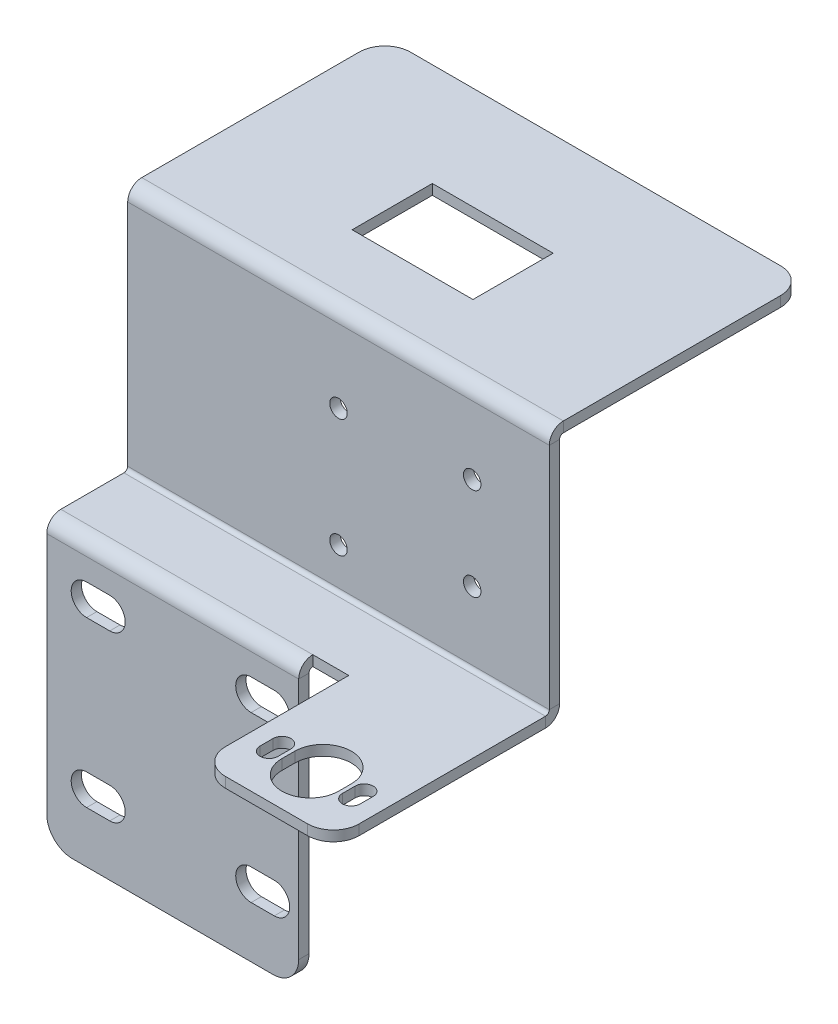
from build123d import *

# Parameters (mm, degrees)
SKETCH1_W                    = 82
SKETCH1_H                    = 50
SKETCH1_W_2                  = 23.5
SKETCH1_H_2                  = 15.6
BASE_FLANGE1_DEPTH           = 2
EDGE_FLANGE1_STRIP_W         = 9.4732
EDGE_FLANGE1_STRIP_H         = 2
EDGE_FLANGE1_STRIP_CUT_DEPTH = 82
EDGE_FLANGE1_DEPTH           = 82
EDGE_FLANGE2_STRIP_W         = 9.4732
EDGE_FLANGE2_STRIP_H         = 2
EDGE_FLANGE2_STRIP_CUT_DEPTH = 82
EDGE_FLANGE2_DEPTH           = 82
CUT_EXTRUDE1_DEPTH           = 153.144667997
CUT_EXTRUDE1_DEPTH_BACK      = 153.144667997
SKETCHED_START               = -63
SKETCHED_BEND2_OUTLINE_W     = 82
SKETCHED_BEND2_OUTLINE_H     = 50
SKETCHED_BEND2_DEPTH         = 63
SKETCHED_START_2             = -92
SKETCHED_BEND2_2_OUTLINE_W   = 26
SKETCHED_BEND2_2_OUTLINE_H   = 2
SKETCHED_BEND2_2_DEPTH       = 27
SKETCHED_START_3             = -62.2634
SKETCHED_BEND2_3_OUTLINE_W   = 82
SKETCHED_BEND2_3_OUTLINE_H   = 2
SKETCHED_BEND2_3_DEPTH       = 44.5268
SKETCHED_START_4             = -65
SKETCHED_BEND2_4_OUTLINE_W   = 26
SKETCHED_BEND2_4_OUTLINE_H   = 26.254644901
SKETCHED_BEND2_4_DEPTH       = 2
SKETCHED_BEND2_5_DEPTH       = 49
SKETCHED_BEND2_6_OUTLINE_W   = 2
SKETCHED_BEND2_6_OUTLINE_H   = 20
SKETCHED_BEND2_6_DEPTH       = 82
SKETCHED_BEND2_7_OUTLINE_W   = 2
SKETCHED_BEND2_7_OUTLINE_H   = 15.6
SKETCHED_BEND2_7_DEPTH       = 29.25
SKETCHED_START_5             = 52.75
SKETCHED_BEND2_8_OUTLINE_W   = 2
SKETCHED_BEND2_8_OUTLINE_H   = 15.6
SKETCHED_BEND2_8_DEPTH       = 29.25
SKETCHED_START_6             = 56
SKETCHED_BEND2_9_OUTLINE_W   = 2
SKETCHED_BEND2_9_OUTLINE_H   = 0.745355099
SKETCHED_BEND2_9_DEPTH       = 26
SKETCHED_START_7             = 29.25
SKETCHED_BEND2_10_DEPTH      = 19.75
FILLET1_R                    = 5
SKETCH19_R                   = 1.7
CUT_EXTRUDE2_DEPTH           = 10


with BuildPart() as part:
    # Base-Flange1: sheet metal written as solids
    # Sketch1 → Base-Flange1 (new body)
    with BuildSketch(Plane.XY):
        with Locations((41, -25)):
            Rectangle(SKETCH1_W, SKETCH1_H)
        with Locations((41, -27.8)):
            Rectangle(SKETCH1_W_2, SKETCH1_H_2, mode=Mode.SUBTRACT)
    extrude(amount=-BASE_FLANGE1_DEPTH)

    # Edge-Flange1: sheet metal written as solids
    # Edge-Flange1 strip (on a plane across the edge) → Edge-Flange1 strip cut (cut)
    with BuildSketch(Plane(origin=(82, -50, -2), x_dir=(0, 1, 0), z_dir=(-1, 0, 0))):
        with Locations((-2, -1)):
            Rectangle(EDGE_FLANGE1_STRIP_W, EDGE_FLANGE1_STRIP_H)
    extrude(amount=EDGE_FLANGE1_STRIP_CUT_DEPTH, mode=Mode.SUBTRACT)

    # Edge-Flange1 section (on a plane across the edge) → Edge-Flange1 (add)
    with BuildSketch(Plane(origin=(82, -50, -2), x_dir=(0, 1, 0), z_dir=(-1, 0, 0))):
        with BuildLine():
            Line((0, 0.7366), (0, 46))
            Line((0, 46), (2, 46))
            Line((2, 46), (2, 0.7366))
            ThreePointArc((2, 0.7366), (2.215745145, 0.215745145), (2.7366, 0))
            Line((2.7366, 0), (2.7366, -2))
            ThreePointArc((2.7366, -2), (0.801531583, -1.198468417), (0, 0.7366))
        make_face()
    extrude(amount=EDGE_FLANGE1_DEPTH)

    # Edge-Flange2: sheet metal written as solids
    # Edge-Flange2 strip (on a plane across the edge) → Edge-Flange2 strip cut (cut)
    with BuildSketch(Plane(origin=(0, -50, -48), x_dir=(0, 0, 1), z_dir=(1, 0, 0))):
        with Locations((-4, -1)):
            Rectangle(EDGE_FLANGE2_STRIP_W, EDGE_FLANGE2_STRIP_H)
    extrude(amount=EDGE_FLANGE2_STRIP_CUT_DEPTH, mode=Mode.SUBTRACT)

    # Edge-Flange2 section (on a plane across the edge) → Edge-Flange2 (add)
    with BuildSketch(Plane(origin=(0, -50, -48), x_dir=(0, 0, 1), z_dir=(1, 0, 0))):
        with BuildLine():
            Line((-2, 0.7366), (-2, 68))
            Line((-2, 68), (0, 68))
            Line((0, 68), (0, 0.7366))
            ThreePointArc((0, 0.7366), (0.215745145, 0.215745145), (0.7366, 0))
            Line((0.7366, 0), (0.7366, -2))
            ThreePointArc((0.7366, -2), (-1.198468417, -1.198468417), (-2, 0.7366))
        make_face()
    extrude(amount=EDGE_FLANGE2_DEPTH)

    # Sketch12 → Cut-Extrude1 (cut, two sides: drawn at the far end of the back side and taken through both)
    with BuildSketch(Plane(origin=(0, 0, -50), x_dir=(-1, 0, 0), z_dir=(0, 0, -1)).offset(-CUT_EXTRUDE1_DEPTH_BACK)):
        Polygon((-56, -92), (-82, -92), (-82, -118), (-49, -118), (-49, -63), (-56, -63), align=None)
        with BuildLine():
            Line((-75.25, -83.5), (-75.25, -81))
            ThreePointArc((-75.25, -81), (-77, -79.25), (-78.75, -81))
            Line((-78.75, -81), (-78.75, -83.5))
            ThreePointArc((-78.75, -83.5), (-77, -85.25), (-75.25, -83.5))
        make_face()
        with BuildLine():
            Line((-63.5, -83.5), (-63.5, -81))
            ThreePointArc((-63.5, -81), (-69, -75.5), (-74.5, -81))
            Line((-74.5, -81), (-74.5, -83.5))
            ThreePointArc((-74.5, -83.5), (-69, -89), (-63.5, -83.5))
        make_face()
        with BuildLine():
            Line((-44.25, -76), (-39.75, -76))
            ThreePointArc((-39.75, -76), (-36.75, -73), (-39.75, -70))
            Line((-39.75, -70), (-44.25, -70))
            ThreePointArc((-44.25, -70), (-47.25, -73), (-44.25, -76))
        make_face()
        with BuildLine():
            Line((-12.25, -76), (-7.75, -76))
            ThreePointArc((-7.75, -76), (-4.75, -73), (-7.75, -70))
            Line((-7.75, -70), (-12.25, -70))
            ThreePointArc((-12.25, -70), (-15.25, -73), (-12.25, -76))
        make_face()
        with BuildLine():
            Line((-12.25, -108), (-7.75, -108))
            ThreePointArc((-7.75, -108), (-4.75, -105), (-7.75, -102))
            Line((-7.75, -102), (-12.25, -102))
            ThreePointArc((-12.25, -102), (-15.25, -105), (-12.25, -108))
        make_face()
        with BuildLine():
            Line((-44.25, -108), (-39.75, -108))
            ThreePointArc((-39.75, -108), (-36.75, -105), (-39.75, -102))
            Line((-39.75, -102), (-44.25, -102))
            ThreePointArc((-44.25, -102), (-47.25, -105), (-44.25, -108))
        make_face()
        with BuildLine():
            ThreePointArc((-59.25, -81), (-61, -79.25), (-62.75, -81))
            Line((-62.75, -81), (-62.75, -83.5))
            ThreePointArc((-62.75, -83.5), (-61, -85.25), (-59.25, -83.5))
            Line((-59.25, -83.5), (-59.25, -81))
        make_face()
    extrude(amount=CUT_EXTRUDE1_DEPTH + CUT_EXTRUDE1_DEPTH_BACK, mode=Mode.SUBTRACT)

    # Sketched Bend2: read off the stored shape, not the designer's step
    # Sketched Bend2 outline → Sketched Bend2 (cut)
    with BuildSketch(Plane(origin=(0, 0, 0), x_dir=(1, 0, 0), z_dir=(0, 1, 0)).offset(SKETCHED_START)):
        with Locations((41, 25)):
            Rectangle(SKETCHED_BEND2_OUTLINE_W, SKETCHED_BEND2_OUTLINE_H)
    extrude(amount=SKETCHED_BEND2_DEPTH, mode=Mode.SUBTRACT)

    # Sketched Bend2 2 outline → Sketched Bend2 2 (cut)
    with BuildSketch(Plane(origin=(0, 0, 0), x_dir=(1, 0, 0), z_dir=(0, 1, 0)).offset(SKETCHED_START_2)):
        with Locations((69, 49)):
            Rectangle(SKETCHED_BEND2_2_OUTLINE_W, SKETCHED_BEND2_2_OUTLINE_H)
    extrude(amount=SKETCHED_BEND2_2_DEPTH, mode=Mode.SUBTRACT)

    # Sketched Bend2 4 outline → Sketched Bend2 4 (add)
    with BuildSketch(Plane(origin=(0, 0, 0), x_dir=(1, 0, 0), z_dir=(0, 1, 0)).offset(SKETCHED_START_4)):
        with Locations((69, 34.872677549)):
            Rectangle(SKETCHED_BEND2_4_OUTLINE_W, SKETCHED_BEND2_4_OUTLINE_H)
        with BuildLine():
            Line((59.25, 30.245355099), (59.25, 32.745355099))
            ThreePointArc((59.25, 32.745355099), (61, 34.495355099), (62.75, 32.745355099))
            Line((62.75, 32.745355099), (62.75, 30.245355099))
            ThreePointArc((62.75, 30.245355099), (61, 28.495355099), (59.25, 30.245355099))
        make_face(mode=Mode.SUBTRACT)
        with BuildLine():
            Line((63.5, 30.245355099), (63.5, 32.745355099))
            ThreePointArc((63.5, 32.745355099), (69, 38.245355099), (74.5, 32.745355099))
            Line((74.5, 32.745355099), (74.5, 30.245355099))
            ThreePointArc((74.5, 30.245355099), (69, 24.745355099), (63.5, 30.245355099))
        make_face(mode=Mode.SUBTRACT)
        with BuildLine():
            Line((75.25, 30.245355099), (75.25, 32.745355099))
            ThreePointArc((75.25, 32.745355099), (77, 34.495355099), (78.75, 32.745355099))
            Line((78.75, 32.745355099), (78.75, 30.245355099))
            ThreePointArc((78.75, 30.245355099), (77, 28.495355099), (75.25, 30.245355099))
        make_face(mode=Mode.SUBTRACT)
    extrude(amount=SKETCHED_BEND2_4_DEPTH)

    # Sketched Bend2 5 outline → Sketched Bend2 5 (cut)
    with BuildSketch(Plane.YZ):
        with BuildLine():
            ThreePointArc((-65.7366, -48), (-64.082332791, -48.556604688), (-63.100997602, -50))
            Line((-63.100997602, -50), (-63, -50))
            Line((-63, -50), (-63, -48))
            Line((-63, -48), (-65.7366, -48))
        make_face()
    extrude(amount=SKETCHED_BEND2_5_DEPTH, mode=Mode.SUBTRACT)



with BuildPart() as body_2:
    # Sketched Bend2 3 outline → Sketched Bend2 3 (new body)
    with BuildSketch(Plane(origin=(0, 0, 0), x_dir=(1, 0, 0), z_dir=(0, 1, 0)).offset(SKETCHED_START_3)):
        with Locations((41, 64.745355099)):
            Rectangle(SKETCHED_BEND2_3_OUTLINE_W, SKETCHED_BEND2_3_OUTLINE_H)
    extrude(amount=SKETCHED_BEND2_3_DEPTH)

    # Sketched Bend2 6 outline → Sketched Bend2 6 (add)
    with BuildSketch(Plane.YZ):
        with BuildLine():
            Line((-65, -50.745355099), (-65, -63.008755099))
            ThreePointArc((-65, -63.008755099), (-64.198468417, -64.943823516), (-62.2634, -65.745355099))
            Line((-62.2634, -65.745355099), (-62.2634, -63.745355099))
            ThreePointArc((-62.2634, -63.745355099), (-62.784254855, -63.529609954), (-63, -63.008755099))
            Line((-63, -63.008755099), (-63, -50.745355099))
            Line((-63, -50.745355099), (-65, -50.745355099))
        make_face()
        with Locations((-16, -103.745355099)):
            Rectangle(SKETCHED_BEND2_6_OUTLINE_W, SKETCHED_BEND2_6_OUTLINE_H)
        with BuildLine():
            Line((-17, -66.481955099), (-17, -78.145355099))
            Line((-17, -78.145355099), (-15, -78.145355099))
            Line((-15, -78.145355099), (-15, -66.481955099))
            ThreePointArc((-15, -66.481955099), (-15.801531582, -64.546886681), (-17.7366, -63.745355099))
            Line((-17.7366, -63.745355099), (-17.7366, -65.745355099))
            ThreePointArc((-17.7366, -65.745355099), (-17.215745145, -65.961100244), (-17, -66.481955099))
        make_face()
    extrude(amount=SKETCHED_BEND2_6_DEPTH)


with BuildPart() as part_1:
    add(part.part)

    add(body_2.part)  # Sketched Bend2 7 merges body 2
    # Sketched Bend2 7 outline → Sketched Bend2 7 (add)
    with BuildSketch(Plane.YZ):
        with BuildLine():
            Line((-65, -50.7366), (-65, -50.745355099))
            Line((-65, -50.745355099), (-63, -50.745355099))
            Line((-63, -50.745355099), (-63, -50.7366))
            ThreePointArc((-63, -50.7366), (-63.025366971, -50.364854094), (-63.100997602, -50))
            Line((-63.100997602, -50), (-65.7366, -50))
            ThreePointArc((-65.7366, -50), (-65.215745145, -50.215745145), (-65, -50.7366))
        make_face()
        with Locations((-16, -85.945355099)):
            Rectangle(SKETCHED_BEND2_7_OUTLINE_W, SKETCHED_BEND2_7_OUTLINE_H)
    extrude(amount=SKETCHED_BEND2_7_DEPTH)

    # Sketched Bend2 8 outline → Sketched Bend2 8 (add)
    with BuildSketch(Plane.YZ.offset(SKETCHED_START_5)):
        with Locations((-16, -85.945355099)):
            Rectangle(SKETCHED_BEND2_8_OUTLINE_W, SKETCHED_BEND2_8_OUTLINE_H)
    extrude(amount=SKETCHED_BEND2_8_DEPTH)

    # Sketched Bend2 9 outline → Sketched Bend2 9 (add)
    with BuildSketch(Plane.YZ.offset(SKETCHED_START_6)):
        with Locations((-64, -50.372677549)):
            Rectangle(SKETCHED_BEND2_9_OUTLINE_W, SKETCHED_BEND2_9_OUTLINE_H)
    extrude(amount=SKETCHED_BEND2_9_DEPTH)

    # Sketched Bend2 10 outline → Sketched Bend2 10 (add)
    with BuildSketch(Plane.YZ.offset(SKETCHED_START_7)):
        with BuildLine():
            Line((-65, -50.7366), (-65, -50.745355099))
            Line((-65, -50.745355099), (-63, -50.745355099))
            Line((-63, -50.745355099), (-63, -50.7366))
            ThreePointArc((-63, -50.7366), (-63.025366971, -50.364854094), (-63.100997602, -50))
            Line((-63.100997602, -50), (-65.7366, -50))
            ThreePointArc((-65.7366, -50), (-65.215745145, -50.215745145), (-65, -50.7366))
        make_face()
    extrude(amount=SKETCHED_BEND2_10_DEPTH)

    # Fillet1
    fillet1_edges = [part_1.edges().sort_by_distance(p)[0] for p in [
        (82, -64, -21.745355099),
        (56, -64, -21.745355099),
        (49, -118, -49),
        (0, -118, -49),
        (0, -16, -113.745355099),
        (82, -16, -113.745355099),
    ]]
    fillet(fillet1_edges, radius=FILLET1_R)

    # Sketch19 → Cut-Extrude2 (cut)
    with BuildSketch(Plane(origin=(0, 0, -65.745355099), x_dir=(-1, 0, 0), z_dir=(0, 0, -1))):
        with Locations(Location((-41, -32, 0), (0, 0, 90))):
            Circle(SKETCH19_R)
        with Locations(Location((-41, -55, 0), (0, 0, 90))):
            Circle(SKETCH19_R)
        with Locations(Location((-67, -31, 0), (0, 0, 90))):
            Circle(SKETCH19_R)
        with Locations(Location((-67, -49, 0), (0, 0, 90))):
            Circle(SKETCH19_R)
    extrude(amount=-CUT_EXTRUDE2_DEPTH, mode=Mode.SUBTRACT)


solid = part_1.part
